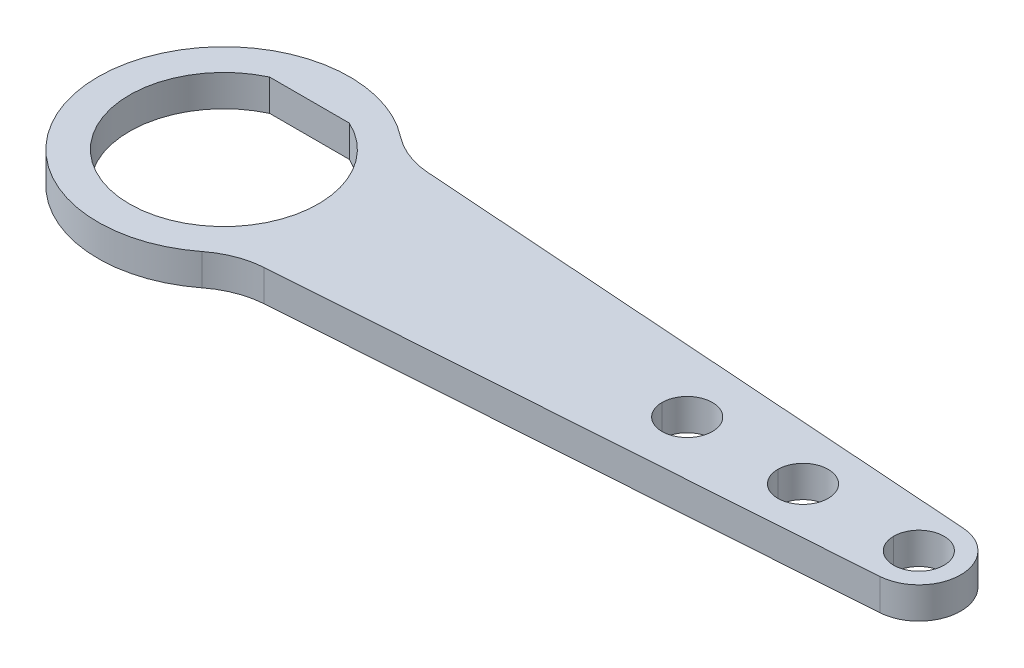
from build123d import *

# Parameters (mm, degrees)
SKETCH1_R               = 2.54
BOSS_EXTRUDE1_DEPTH     = 3.175
CUT_EXTRUDE1_DEPTH      = 76.467099971
CUT_EXTRUDE1_DEPTH_BACK = 76.467099971


with BuildPart() as part:
    # Sketch1 → Boss-Extrude1 (new body)
    with BuildSketch(Plane(origin=(0, 0, 0), x_dir=(1, 0, 0), z_dir=(0, 1, 0))):
        with BuildLine():
            Line((70.398754346, 4.208719598), (12.331459303, 8.275416651))
            ThreePointArc((12.331459303, 8.275416651), (9.945619767, 8.804529388), (7.81864817, 10.007933893))
            ThreePointArc((7.81864817, 10.007933893), (-12.7, 0), (7.81864817, -10.007933893))
            ThreePointArc((7.81864817, -10.007933893), (9.945619767, -8.804529388), (12.331459303, -8.275416651))
            Line((12.331459303, -8.275416651), (70.398754346, -4.208719598))
            ThreePointArc((70.398754346, -4.208719598), (74.323028417, 0), (70.398754346, 4.208719598))
        make_face()
        with Locations((70.104, 0)):
            Circle(SKETCH1_R, mode=Mode.SUBTRACT)
        with Locations((58.42, 0)):
            Circle(SKETCH1_R, mode=Mode.SUBTRACT)
        with Locations((46.736, 0)):
            Circle(SKETCH1_R, mode=Mode.SUBTRACT)
    extrude(amount=BOSS_EXTRUDE1_DEPTH)

    # Sketch3 → Cut-Extrude1 (cut, two sides: drawn at the far end of the back side and taken through both)
    with BuildSketch(Plane(origin=(0, 0, 0), x_dir=(1, 0, 0), z_dir=(0, 1, 0)).offset(-CUT_EXTRUDE1_DEPTH_BACK)):
        with BuildLine():
            Line((-4.018100173, 8.636), (4.018100173, 8.636))
            ThreePointArc((4.018100173, 8.636), (0, -9.525), (-4.018100173, 8.636))
        make_face()
    extrude(amount=CUT_EXTRUDE1_DEPTH + CUT_EXTRUDE1_DEPTH_BACK, mode=Mode.SUBTRACT)


solid = part.part
